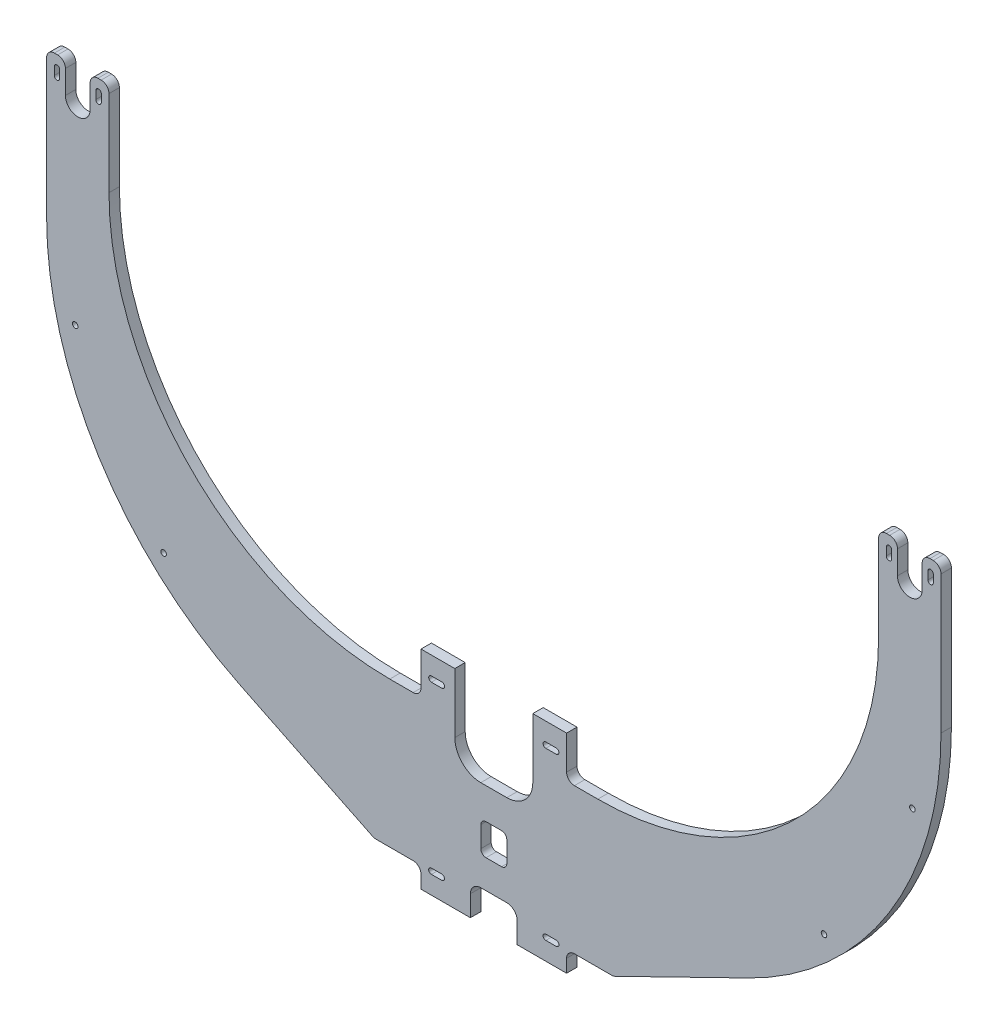
from build123d import *

# Parameters (mm, degrees)
BOSS_EXTRUDE1_DEPTH          = 12.7
CUT_EXTRUDE1_DEPTH           = 666.993618588
G_0_261_DIAMETER_SLOT1_DEPTH = 12.7
G_0_261_DIAMETER_SLOT2_DEPTH = 12.7
FILLET1_R                    = 9.525
SKETCH9_W                    = 57.15
SKETCH9_H                    = 38.1
CUT_EXTRUDE2_DEPTH           = 666.993618588
FILLET3_R                    = 12.7
SKETCH10_W                   = 95.25
SKETCH10_H                   = 104.775
CUT_EXTRUDE3_DEPTH           = 666.993618588
FILLET4_R                    = 31.75
F_1_4_CLEARANCE_HOLE1_D      = 6.7564
SKETCH13_W                   = 31.75
SKETCH13_H                   = 38.1
CUT_EXTRUDE4_DEPTH           = 666.993618588
FILLET5_R                    = 6.35


# Read off the part's stored shape, not the designer's step: G (0.261) Diameter Slot1, G (0.261) Diameter Slot2
with BuildPart() as part:
    # Sketch2 → Boss-Extrude1 (new body)
    with BuildSketch(Plane.XY):
        with BuildLine():
            Line((-88.9, -254), (-88.9, -279.4))
            Line((-88.9, -279.4), (88.9, -279.4))
            Line((88.9, -279.4), (88.9, -254))
            Line((88.9, -254), (146.05, -254))
            Line((146.05, -254), (311.089942486, -173.30458573))
            ThreePointArc((311.089942486, -173.30458573), (482.525600271, -18.715203517), (546.1, 203.2))
            Line((546.1, 203.2), (546.1, 304.8))
            Line((546.1, 304.8), (546.1, 381))
            Line((546.1, 381), (469.9, 381))
            Line((469.9, 381), (469.9, 304.8))
            Line((469.9, 304.8), (469.9, 266.7))
            ThreePointArc((469.9, 266.7), (369.466915269, 24.233084731), (127, -76.2))
            Line((127, -76.2), (88.9, -76.2))
            Line((88.9, -76.2), (88.9, -25.4))
            Line((88.9, -25.4), (-88.9, -25.4))
            Line((-88.9, -25.4), (-88.9, -76.2))
            Line((-88.9, -76.2), (-127, -76.2))
            ThreePointArc((-127, -76.2), (-369.466915269, 24.233084731), (-469.9, 266.7))
            Line((-469.9, 266.7), (-469.9, 304.8))
            Line((-469.9, 304.8), (-469.9, 381))
            Line((-469.9, 381), (-546.1, 381))
            Line((-546.1, 381), (-546.1, 304.8))
            Line((-546.1, 304.8), (-546.1, 203.2))
            ThreePointArc((-546.1, 203.2), (-482.525600271, -18.715203517), (-311.089942486, -173.30458573))
            Line((-311.089942486, -173.30458573), (-146.05, -254))
            Line((-146.05, -254), (-88.9, -254))
        make_face()
    extrude(amount=BOSS_EXTRUDE1_DEPTH)

    # Sketch3 → Cut-Extrude1 (cut, through all)
    with BuildSketch(Plane.XY.offset(12.7)):
        with BuildLine():
            Line((-523.0876, 342.9), (-523.0876, 381))
            Line((-523.0876, 381), (-492.9124, 381))
            Line((-492.9124, 381), (-492.9124, 342.9))
            ThreePointArc((-492.9124, 342.9), (-508, 327.8124), (-523.0876, 342.9))
        make_face()
        with BuildLine():
            Line((492.9124, 342.9), (492.9124, 381))
            Line((492.9124, 381), (523.0876, 381))
            Line((523.0876, 381), (523.0876, 342.9))
            ThreePointArc((523.0876, 342.9), (508, 327.8124), (492.9124, 342.9))
        make_face()
    extrude(amount=-CUT_EXTRUDE1_DEPTH, mode=Mode.SUBTRACT)

    # G (0.261) Diameter Slot1 outline → G (0.261) Diameter Slot1 (cut)
    with BuildSketch(Plane.XY):
        with BuildLine():
            ThreePointArc((-63.5, -257.3147), (-60.1853, -254), (-63.5, -250.6853))
            Line((-63.5, -250.6853), (-76.2, -250.6853))
            ThreePointArc((-76.2, -250.6853), (-79.5147, -254), (-76.2, -257.3147))
            Line((-76.2, -257.3147), (-63.5, -257.3147))
        make_face()
        with BuildLine():
            ThreePointArc((63.5, -250.6853), (60.1853, -254), (63.5, -257.3147))
            Line((63.5, -257.3147), (76.2, -257.3147))
            ThreePointArc((76.2, -257.3147), (79.5147, -254), (76.2, -250.6853))
            Line((76.2, -250.6853), (63.5, -250.6853))
        make_face()
        with BuildLine():
            ThreePointArc((-63.5, -54.1147), (-60.1853, -50.8), (-63.5, -47.4853))
            Line((-63.5, -47.4853), (-76.2, -47.4853))
            ThreePointArc((-76.2, -47.4853), (-79.5147, -50.8), (-76.2, -54.1147))
            Line((-76.2, -54.1147), (-63.5, -54.1147))
        make_face()
        with BuildLine():
            ThreePointArc((63.5, -47.4853), (60.1853, -50.8), (63.5, -54.1147))
            Line((63.5, -54.1147), (76.2, -54.1147))
            ThreePointArc((76.2, -54.1147), (79.5147, -50.8), (76.2, -47.4853))
            Line((76.2, -47.4853), (63.5, -47.4853))
        make_face()
    extrude(amount=G_0_261_DIAMETER_SLOT1_DEPTH, mode=Mode.SUBTRACT)

    # G (0.261) Diameter Slot2 outline → G (0.261) Diameter Slot2 (cut)
    with BuildSketch(Plane.XY):
        with BuildLine():
            ThreePointArc((-479.2853, 366.7125), (-482.6, 370.0272), (-485.9147, 366.7125))
            Line((-485.9147, 366.7125), (-485.9147, 357.1875))
            ThreePointArc((-485.9147, 357.1875), (-482.6, 353.8728), (-479.2853, 357.1875))
            Line((-479.2853, 357.1875), (-479.2853, 366.7125))
        make_face()
        with BuildLine():
            ThreePointArc((-530.0853, 366.7125), (-533.4, 370.0272), (-536.7147, 366.7125))
            Line((-536.7147, 366.7125), (-536.7147, 357.1875))
            ThreePointArc((-536.7147, 357.1875), (-533.4, 353.8728), (-530.0853, 357.1875))
            Line((-530.0853, 357.1875), (-530.0853, 366.7125))
        make_face()
        with BuildLine():
            ThreePointArc((485.9147, 366.7125), (482.6, 370.0272), (479.2853, 366.7125))
            Line((479.2853, 366.7125), (479.2853, 357.1875))
            ThreePointArc((479.2853, 357.1875), (482.6, 353.8728), (485.9147, 357.1875))
            Line((485.9147, 357.1875), (485.9147, 366.7125))
        make_face()
        with BuildLine():
            ThreePointArc((536.7147, 366.7125), (533.4, 370.0272), (530.0853, 366.7125))
            Line((530.0853, 366.7125), (530.0853, 357.1875))
            ThreePointArc((530.0853, 357.1875), (533.4, 353.8728), (536.7147, 357.1875))
            Line((536.7147, 357.1875), (536.7147, 366.7125))
        make_face()
    extrude(amount=G_0_261_DIAMETER_SLOT2_DEPTH, mode=Mode.SUBTRACT)

    # Fillet1
    fillet1_edges = [part.edges().sort_by_distance(p)[0] for p in [
        (469.9, 381, 6.35),
        (546.1, 381, 6.35),
        (146.05, -254, 6.35),
        (88.9, -254, 6.35),
        (-88.9, -254, 6.35),
        (-146.05, -254, 6.35),
        (-546.1, 381, 6.35),
        (-469.9, 381, 6.35),
        (-88.9, -76.2, 6.35),
        (88.9, -76.2, 6.35),
        (492.9124, 381, 6.35),
        (523.0876, 381, 6.35),
        (-523.0876, 381, 6.35),
        (-492.9124, 381, 6.35),
    ]]
    fillet(fillet1_edges, radius=FILLET1_R)

    # Sketch9 → Cut-Extrude2 (cut, through all)
    with BuildSketch(Plane.XY.offset(12.7)):
        with Locations((0, -260.35)):
            Rectangle(SKETCH9_W, SKETCH9_H)
    extrude(amount=-CUT_EXTRUDE2_DEPTH, mode=Mode.SUBTRACT)

    # Fillet3
    fillet3_edges = [part.edges().sort_by_distance(p)[0] for p in [
        (-28.575, -241.3, 6.35),
        (28.575, -241.3, 6.35),
    ]]
    fillet(fillet3_edges, radius=FILLET3_R)

    # Sketch10 → Cut-Extrude3 (cut, through all)
    with BuildSketch(Plane.XY.offset(12.7)):
        with Locations((0, -77.7875)):
            Rectangle(SKETCH10_W, SKETCH10_H)
    extrude(amount=-CUT_EXTRUDE3_DEPTH, mode=Mode.SUBTRACT)

    # Fillet4
    fillet4_edges = [part.edges().sort_by_distance(p)[0] for p in [
        (-47.625, -130.175, 6.35),
        (47.625, -130.175, 6.35),
    ]]
    fillet(fillet4_edges, radius=FILLET4_R)

    # 1/4 Clearance Hole1 (through all)
    with Locations(Plane.XY.offset(12.7)):
        with Locations((403.225, -80.928501225), (511.175, 106.046383452)):
            f_1_4_clearance_hole1 = Hole(F_1_4_CLEARANCE_HOLE1_D / 2)

    # Mirror1: 1/4 Clearance Hole1 across plane
    add(f_1_4_clearance_hole1.mirror(Plane(origin=(0, 0, 0), x_dir=(0, 0, 1), z_dir=(1, 0, 0))), mode=Mode.SUBTRACT)

    # Sketch13 → Cut-Extrude4 (cut, through all)
    with BuildSketch(Plane.XY.offset(12.7)):
        with Locations((0, -187.325)):
            Rectangle(SKETCH13_W, SKETCH13_H)
    extrude(amount=-CUT_EXTRUDE4_DEPTH, mode=Mode.SUBTRACT)

    # Fillet5
    fillet5_edges = [part.edges().sort_by_distance(p)[0] for p in [
        (15.875, -168.275, 6.35),
        (15.875, -206.375, 6.35),
        (-15.875, -206.375, 6.35),
        (-15.875, -168.275, 6.35),
    ]]
    fillet(fillet5_edges, radius=FILLET5_R)


solid = part.part
